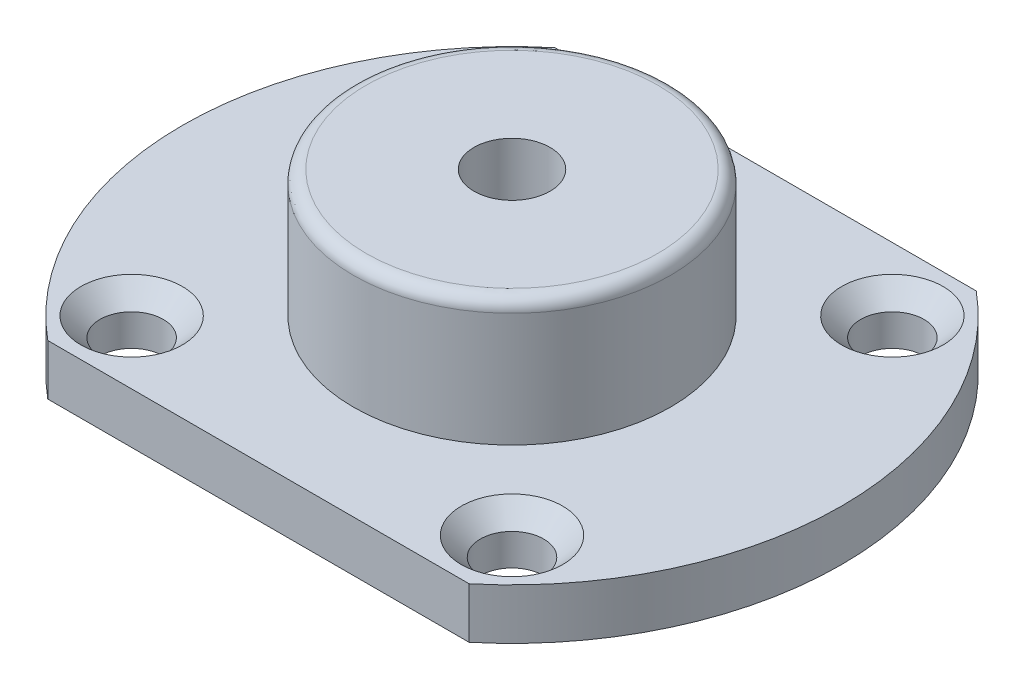
from build123d import *

# Parameters (mm, degrees)
SKETCH_1_R           = 26
EXTRUDE_1_DEPTH      = 4
SKETCH_2_OUTSIDE_W   = 68.73
SKETCH_2_OUTSIDE_H   = 68.73
SKETCH_2_OUTSIDE_W_2 = 65.720202688
SKETCH_2_OUTSIDE_H_2 = 40
CUT_EXTRUDE_1_DEPTH  = 4
SKETCH_3_R           = 12.5
EXTRUDE_2_DEPTH      = 10
FILLET_1_R           = 1
CUT_EXTRUDE_2_REACH  = 37.665
SKETCH_4_R           = 3
CUT_EXTRUDE_3_REACH  = 36.293
SKETCH_5_R           = 2.5
CHAMFER_1_SIZE       = 1.5


with BuildPart() as part:
    # Эскиз1 → Бобышка-Вытянуть1 (new body)
    with BuildSketch(Plane(origin=(0, 0, 0), x_dir=(1, 0, 0), z_dir=(0, 1, 0))):
        Circle(SKETCH_1_R)
    extrude(amount=EXTRUDE_1_DEPTH)

    # Эскиз2 outside → Вырез-Вытянуть1 (cut)
    with BuildSketch(Plane(origin=(0, 4, 0), x_dir=(1, 0, 0), z_dir=(0, 1, 0))):
        Rectangle(SKETCH_2_OUTSIDE_W, SKETCH_2_OUTSIDE_H)
        Rectangle(SKETCH_2_OUTSIDE_W_2, SKETCH_2_OUTSIDE_H_2, mode=Mode.SUBTRACT)
    extrude(amount=-CUT_EXTRUDE_1_DEPTH, mode=Mode.SUBTRACT)

    # Эскиз3 → Бобышка-Вытянуть2 (add)
    with BuildSketch(Plane(origin=(0, 4, 0), x_dir=(1, 0, 0), z_dir=(0, 1, 0))):
        Circle(SKETCH_3_R)
    extrude(amount=EXTRUDE_2_DEPTH)

    # Скругление1
    fillet_1_edges = [part.edges().sort_by_distance(p)[0] for p in [
        (-12.5, 14, 0),
    ]]
    fillet(fillet_1_edges, radius=FILLET_1_R)

    # Эскиз4 → Вырез-Вытянуть2 (cut, up to next)
    with BuildSketch(Plane(origin=(0, 14, 0), x_dir=(1, 0, 0), z_dir=(0, 1, 0)), mode=Mode.PRIVATE) as cut_extrude_2_sk1:
        Circle(SKETCH_4_R)
    cut_extrude_2_tool1 = extrude(cut_extrude_2_sk1.sketch, amount=-CUT_EXTRUDE_2_REACH, mode=Mode.PRIVATE) & part.part
    add(cut_extrude_2_tool1.solids().sort_by_distance((0, 14, 0))[0], mode=Mode.SUBTRACT)

    # Эскиз5 → Вырез-Вытянуть3 (cut, up to next)
    with BuildSketch(Plane(origin=(0, 4, 0), x_dir=(1, 0, 0), z_dir=(0, 1, 0)), mode=Mode.PRIVATE) as cut_extrude_3_sk1:
        with Locations((-15, 15)):
            Circle(SKETCH_5_R)
    cut_extrude_3_tool1 = extrude(cut_extrude_3_sk1.sketch, amount=-CUT_EXTRUDE_3_REACH, mode=Mode.PRIVATE) & part.part
    # Эскиз5 → Вырез-Вытянуть3 (cut, up to next)
    with BuildSketch(Plane(origin=(0, 4, 0), x_dir=(1, 0, 0), z_dir=(0, 1, 0)), mode=Mode.PRIVATE) as cut_extrude_3_sk2:
        with Locations((15, 15)):
            Circle(SKETCH_5_R)
    cut_extrude_3_tool2 = extrude(cut_extrude_3_sk2.sketch, amount=-CUT_EXTRUDE_3_REACH, mode=Mode.PRIVATE) & part.part
    # Эскиз5 → Вырез-Вытянуть3 (cut, up to next)
    with BuildSketch(Plane(origin=(0, 4, 0), x_dir=(1, 0, 0), z_dir=(0, 1, 0)), mode=Mode.PRIVATE) as cut_extrude_3_sk3:
        with Locations((15, -15)):
            Circle(SKETCH_5_R)
    cut_extrude_3_tool3 = extrude(cut_extrude_3_sk3.sketch, amount=-CUT_EXTRUDE_3_REACH, mode=Mode.PRIVATE) & part.part
    # Эскиз5 → Вырез-Вытянуть3 (cut, up to next)
    with BuildSketch(Plane(origin=(0, 4, 0), x_dir=(1, 0, 0), z_dir=(0, 1, 0)), mode=Mode.PRIVATE) as cut_extrude_3_sk4:
        with Locations((-15, -15)):
            Circle(SKETCH_5_R)
    cut_extrude_3_tool4 = extrude(cut_extrude_3_sk4.sketch, amount=-CUT_EXTRUDE_3_REACH, mode=Mode.PRIVATE) & part.part
    add(cut_extrude_3_tool1.solids().sort_by_distance((-15, 4, -15))[0], mode=Mode.SUBTRACT)
    add(cut_extrude_3_tool2.solids().sort_by_distance((15, 4, -15))[0], mode=Mode.SUBTRACT)
    add(cut_extrude_3_tool3.solids().sort_by_distance((15, 4, 15))[0], mode=Mode.SUBTRACT)
    add(cut_extrude_3_tool4.solids().sort_by_distance((-15, 4, 15))[0], mode=Mode.SUBTRACT)

    # Фаска1
    chamfer_1_edges = [part.edges().sort_by_distance(p)[0] for p in [
        (12.5, 4, -15),
        (12.5, 4, 15),
        (-17.5, 4, 15),
        (-17.5, 4, -15),
    ]]
    chamfer(chamfer_1_edges, length=CHAMFER_1_SIZE)


solid = part.part
